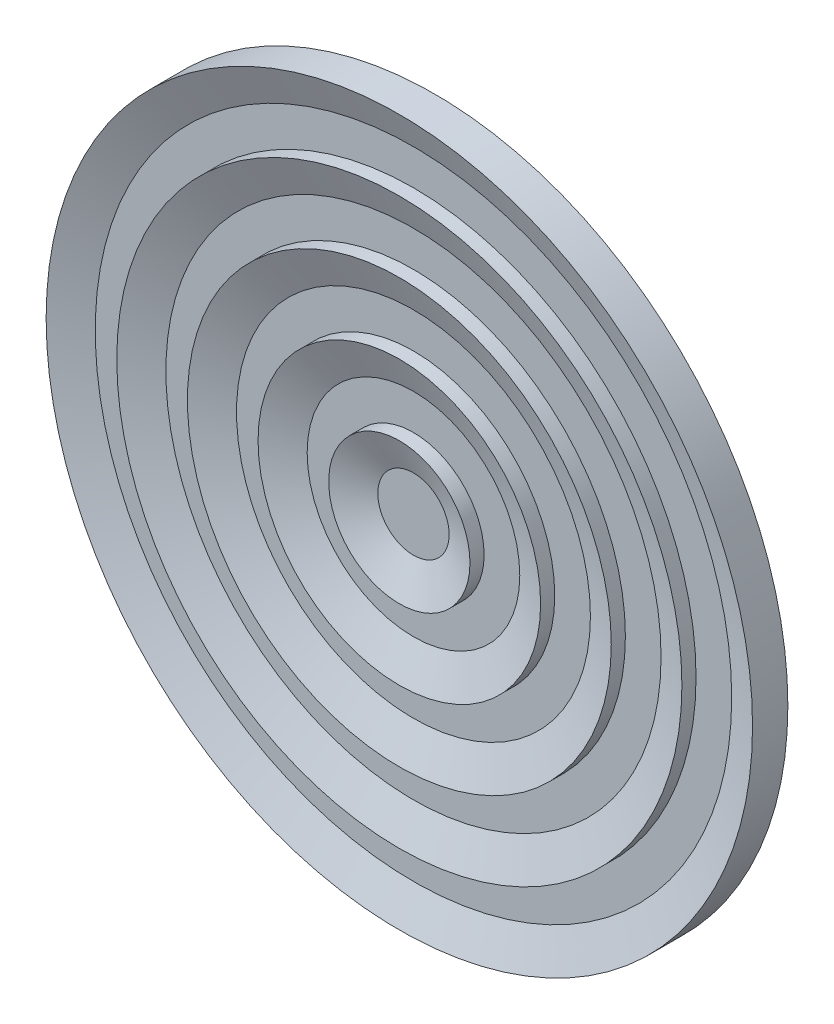
from build123d import *

# Parameters (mm, degrees)
ESQUISSE1_R             = 5
BOSS_EXTRU_1_DEPTH      = 0.5
ESQUISSE2_R             = 4.5
ESQUISSE2_R_2           = 4
ESQUISSE2_R_3           = 3.5
ESQUISSE2_R_4           = 3
ESQUISSE2_R_5           = 2.5
ESQUISSE2_R_6           = 2
ESQUISSE2_R_7           = 1.5
ESQUISSE2_R_8           = 1
ESQUISSE2_R_9           = 0.5
ENL_V_MAT_EXTRU_2_DEPTH = 0.2
CHANFREIN1_SIZE         = 0.5
CHANFREIN1_SIZE_2       = 0.202013113


with BuildPart() as part:
    # Esquisse1 → Boss.-Extru.1 (new body)
    with BuildSketch(Plane.XY):
        Circle(ESQUISSE1_R)
    extrude(amount=BOSS_EXTRU_1_DEPTH)

    # Esquisse2 → Enlèv. mat.-Extru.2 (cut)
    # profile 1 of 5: a face of its own
    with BuildSketch(Plane.XY.offset(0.5)):
        Circle(ESQUISSE2_R)
        Circle(ESQUISSE2_R_2, mode=Mode.SUBTRACT)
    # profile 2 of 5: a face of its own
    with BuildSketch(Plane.XY.offset(0.5)):
        Circle(ESQUISSE2_R_3)
        Circle(ESQUISSE2_R_4, mode=Mode.SUBTRACT)
    # profile 3 of 5: a face of its own
    with BuildSketch(Plane.XY.offset(0.5)):
        Circle(ESQUISSE2_R_5)
        Circle(ESQUISSE2_R_6, mode=Mode.SUBTRACT)
    # profile 4 of 5: a face of its own
    with BuildSketch(Plane.XY.offset(0.5)):
        Circle(ESQUISSE2_R_7)
        Circle(ESQUISSE2_R_8, mode=Mode.SUBTRACT)
    # profile 5 of 5: a face of its own
    with BuildSketch(Plane.XY.offset(0.5)):
        Circle(ESQUISSE2_R_9)
    extrude(amount=-ENL_V_MAT_EXTRU_2_DEPTH, mode=Mode.SUBTRACT)

    # Chanfrein1
    # the kernel refuses this chamfer: 0.5, 0.202013113 mm, written as the material it takes off along each edge
    with BuildSketch(Plane(origin=(0, 0, 0.5), x_dir=(1, 0, 0), z_dir=(0, -1, 0))) as chanfrein1_piece_1_section:
        Polygon((0.5 + CHANFREIN1_SIZE, 0), (0.5, -CHANFREIN1_SIZE_2), (0.5, 0), align=None)
    chanfrein1_piece_1 = revolve(axis=Axis((0, 0, 0.5), (0, 0, 1)), mode=Mode.PRIVATE)
    chanfrein1_piece_1 = split(chanfrein1_piece_1, bisect_by=Plane(origin=(-0.759410198, 0, 0.3), z_dir=(0, 0, 1)), keep=Keep.TOP, mode=Mode.PRIVATE)
    add(chanfrein1_piece_1, mode=Mode.SUBTRACT)
    with BuildSketch(Plane(origin=(0, 0, 0.5), x_dir=(1, 0, 0), z_dir=(0, -1, 0))) as chanfrein1_piece_2_section:
        Polygon((1.5 + CHANFREIN1_SIZE, 0), (1.5, -CHANFREIN1_SIZE_2), (1.5, 0), align=None)
    chanfrein1_piece_2 = revolve(axis=Axis((0, 0, 0.5), (0, 0, 1)), mode=Mode.PRIVATE)
    chanfrein1_piece_2 = split(chanfrein1_piece_2, bisect_by=Plane(origin=(-1.758573668, 0, 0.3), z_dir=(0, 0, 1)), keep=Keep.TOP, mode=Mode.PRIVATE)
    add(chanfrein1_piece_2, mode=Mode.SUBTRACT)
    with BuildSketch(Plane(origin=(0, 0, 0.5), x_dir=(1, 0, 0), z_dir=(0, -1, 0))) as chanfrein1_piece_3_section:
        Polygon((2.5 + CHANFREIN1_SIZE, 0), (2.5, -CHANFREIN1_SIZE_2), (2.5, 0), align=None)
    chanfrein1_piece_3 = revolve(axis=Axis((0, 0, 0.5), (0, 0, 1)), mode=Mode.PRIVATE)
    chanfrein1_piece_3 = split(chanfrein1_piece_3, bisect_by=Plane(origin=(-2.75803387, 0, 0.3), z_dir=(0, 0, 1)), keep=Keep.TOP, mode=Mode.PRIVATE)
    add(chanfrein1_piece_3, mode=Mode.SUBTRACT)
    with BuildSketch(Plane(origin=(0, 0, 0.5), x_dir=(1, 0, 0), z_dir=(0, -1, 0))) as chanfrein1_piece_4_section:
        Polygon((3.5 + CHANFREIN1_SIZE, 0), (3.5, -CHANFREIN1_SIZE_2), (3.5, 0), align=None)
    chanfrein1_piece_4 = revolve(axis=Axis((0, 0, 0.5), (0, 0, 1)), mode=Mode.PRIVATE)
    chanfrein1_piece_4 = split(chanfrein1_piece_4, bisect_by=Plane(origin=(-3.757616815, 0, 0.3), z_dir=(0, 0, 1)), keep=Keep.TOP, mode=Mode.PRIVATE)
    add(chanfrein1_piece_4, mode=Mode.SUBTRACT)
    with BuildSketch(Plane(origin=(0, 0, 0.5), x_dir=(1, 0, 0), z_dir=(0, -1, 0))) as chanfrein1_piece_5_section:
        Polygon((4.5 + CHANFREIN1_SIZE, 0), (4.5, -CHANFREIN1_SIZE_2), (4.5, 0), align=None)
    chanfrein1_piece_5 = revolve(axis=Axis((0, 0, 0.5), (0, 0, 1)), mode=Mode.PRIVATE)
    chanfrein1_piece_5 = split(chanfrein1_piece_5, bisect_by=Plane(origin=(-4.757270103, 0, 0.3), z_dir=(0, 0, 1)), keep=Keep.TOP, mode=Mode.PRIVATE)
    add(chanfrein1_piece_5, mode=Mode.SUBTRACT)


solid = part.part
